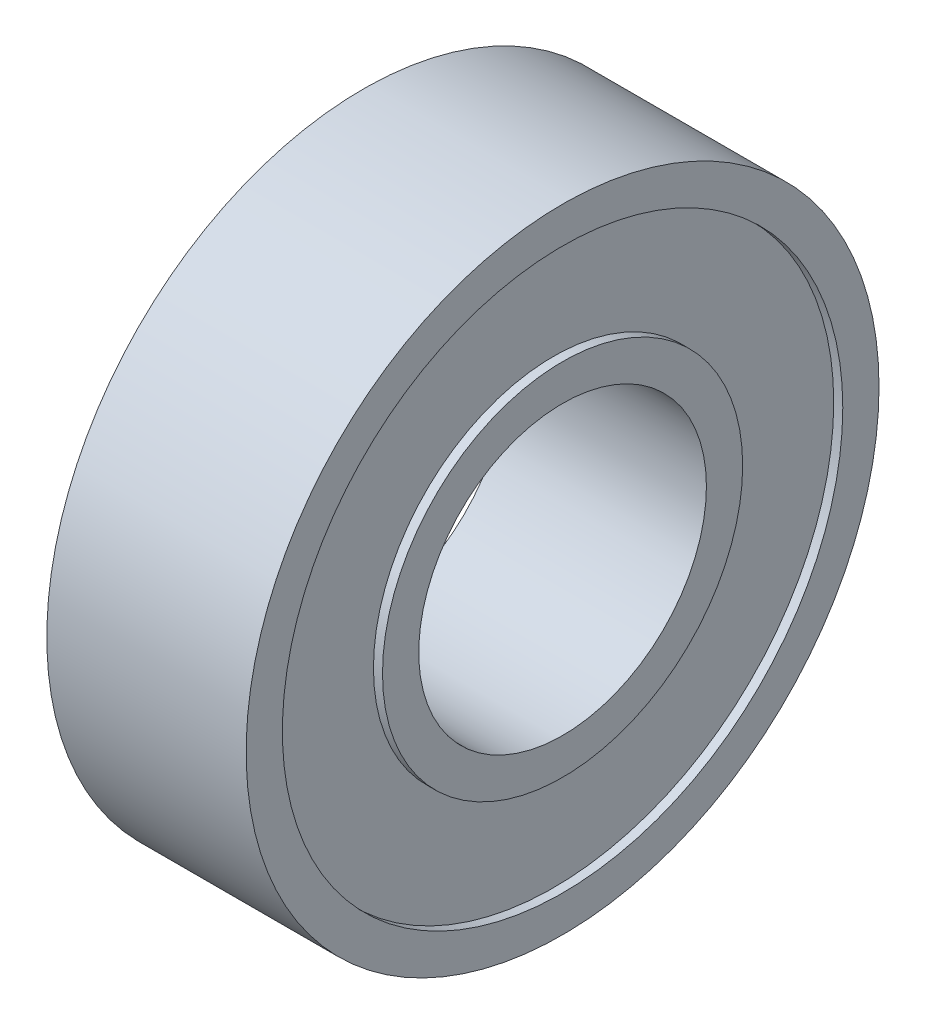
from build123d import *


with BuildPart() as part:
    # Sketch1 → Revolve1 (revolve)
    with BuildSketch(Plane.XY):
        Polygon((-5.5, 9.9375), (-5.5, 7.9375), (5.5, 7.9375), (5.5, 9.9375), (5, 9.9375), (5, 15.4625), (5.5, 15.4625), (5.5, 17.4625), (-5.5, 17.4625), (-5.5, 15.4625), (-5, 15.4625), (-5, 9.9375), align=None)
    revolve(axis=Axis((0, 0, 0), (-1, 0, 0)))


solid = part.part
